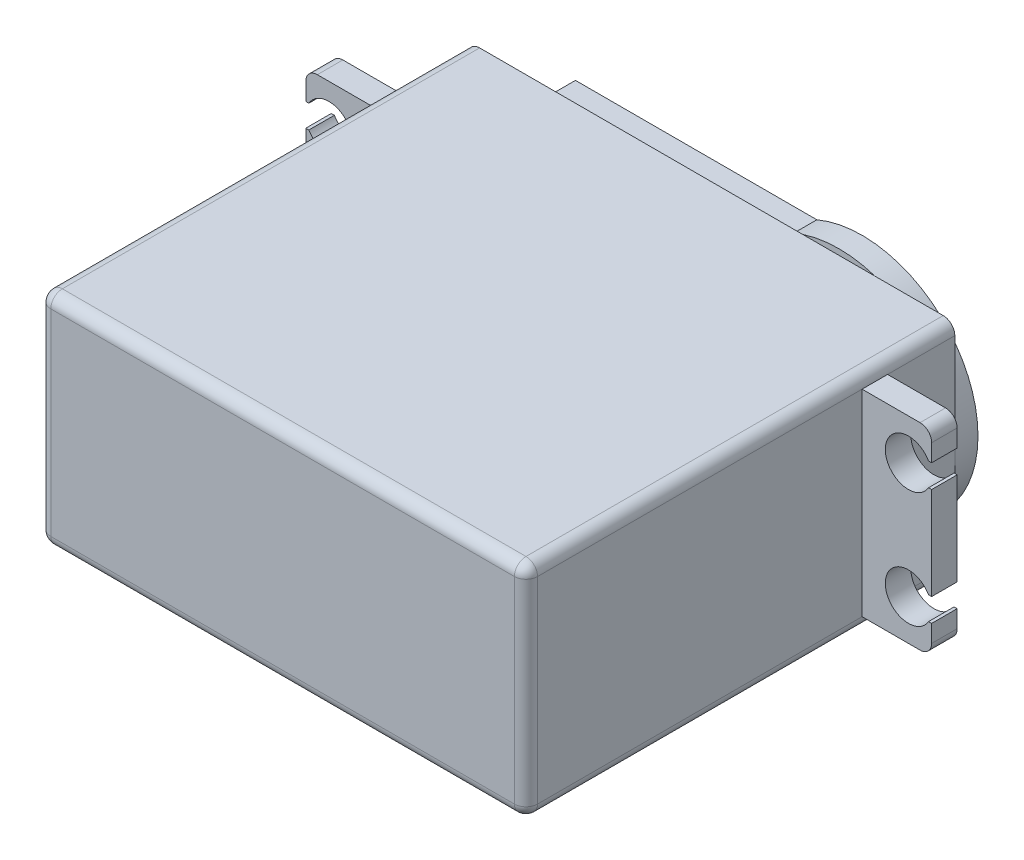
from build123d import *

# Parameters (mm, degrees)
SKETCH2_W            = 42
SKETCH2_H            = 37
BOSS_EXTRUDE1_DEPTH  = 19
FILLET1_R            = 1
FILLET2_R            = 1
SKETCH3_W            = 2.2
SKETCH3_H            = 8.5
BOSS_EXTRUDE2_DEPTH  = 6
SKETCH4_W            = 6
SKETCH4_H            = 1
BOSS_EXTRUDE3_DEPTH  = 1
CHAMFER1_SIZE2       = 1
CHAMFER1_SIZE        = 6
FILLET3_R            = 1
CUT_EXTRUDE1_DEPTH   = 6
FILLET3_OF_MIRROR9_R = 1
CHAMFER2_SIZE        = 1
CHAMFER2_SIZE_2      = 6
FILLET4_R            = 1
BOSS_EXTRUDE4_DEPTH  = 2
SKETCH9_R            = 6.574433214
BOSS_EXTRUDE5_DEPTH  = 1
SKETCH10_R           = 5.689687475
BOSS_EXTRUDE6_DEPTH  = 0.7
SKETCH11_R           = 1.55
CUT_EXTRUDE2_DEPTH   = 10


# Some blends are built 0.0001 mm under size
with BuildPart() as part:
    # Sketch2 → Boss-Extrude1 (new body)
    with BuildSketch(Plane(origin=(0, 0, 0), x_dir=(1, 0, 0), z_dir=(0, 1, 0))):
        with Locations((-10.021609405, 3.404712932)):
            Rectangle(SKETCH2_W, SKETCH2_H)
    extrude(amount=BOSS_EXTRUDE1_DEPTH)

    # Fillet1
    fillet1_edges = [part.edges().sort_by_distance(p)[0] for p in [
        (10.978390595, 19, -3.404712932),
    ]]
    fillet(fillet1_edges, radius=FILLET1_R)

    # Fillet2
    fillet2_edges = [part.edges().sort_by_distance(p)[0] for p in [
        (-31.021609405, 19, -3.404712932),
        (10.978390595, 0, -3.404712932),
        (-31.021609405, 0, -3.404712932),
    ]]
    fillet(fillet2_edges, radius=FILLET2_R)

    # Sketch3 → Boss-Extrude2 (add)
    with BuildSketch(Plane(origin=(10.978390595, 0, 0), x_dir=(0, 0, -1), z_dir=(1, 0, 0))):
        with Locations((15.004712932, 5.25)):
            Rectangle(SKETCH3_W, SKETCH3_H)
        with Locations((15.004712932, 13.75)):
            Rectangle(SKETCH3_W, SKETCH3_H)
    boss_extrude2 = extrude(amount=BOSS_EXTRUDE2_DEPTH)

    # Sketch4 → Boss-Extrude3 (add)
    with BuildSketch(Plane(origin=(0, 0, -16.104712932), x_dir=(-1, 0, 0), z_dir=(0, 0, -1))):
        with Locations((-13.978390595, 9.5)):
            Rectangle(SKETCH4_W, SKETCH4_H)
    boss_extrude3 = extrude(amount=BOSS_EXTRUDE3_DEPTH)

    # Chamfer1
    chamfer1_edges = [part.edges().sort_by_distance(p)[0] for p in [
        (16.978390595, 9.5, -17.104712932),
    ]]
    chamfer1_side = [part.faces().sort_by_distance(p)[0] for p in [
        (16.958390595, 9.5, -17.104712932),
    ]]
    chamfer(chamfer1_edges, length=CHAMFER1_SIZE - 0.0001, length2=CHAMFER1_SIZE2 - 0.0001, reference=chamfer1_side[0])  # a hair under: the kernel refuses the full size

    # Fillet3
    fillet3_edges = [part.edges().sort_by_distance(p)[0] for p in [
        (16.978390595, 18, -15.004712932),
        (16.978390595, 1, -15.004712932),
    ]]
    fillet(fillet3_edges, radius=FILLET3_R)

    # Sketch5 → Cut-Extrude1 (cut)
    with BuildSketch(Plane(origin=(0, 0, -16.104712932), x_dir=(-1, 0, 0), z_dir=(0, 0, -1))):
        with BuildLine():
            Line((-16.978390595, 15.5), (-16.978390595, 13.5))
            Line((-16.978390595, 13.5), (-16.710441403, 13.5))
            ThreePointArc((-16.710441403, 13.5), (-12.978390595, 14.5), (-16.710441403, 15.5))
            Line((-16.710441403, 15.5), (-16.978390595, 15.5))
        make_face()
        with BuildLine():
            Line((-16.978390595, 3.5), (-16.978390595, 5.5))
            Line((-16.978390595, 5.5), (-16.710441403, 5.5))
            ThreePointArc((-16.710441403, 5.5), (-12.978390595, 4.5), (-16.710441403, 3.5))
            Line((-16.710441403, 3.5), (-16.978390595, 3.5))
        make_face()
    cut_extrude1 = extrude(amount=-CUT_EXTRUDE1_DEPTH, mode=Mode.SUBTRACT)

    # Mirror9: Boss-Extrude2, Boss-Extrude3, Cut-Extrude1 across plane
    add(boss_extrude2.mirror(Plane(origin=(-10.021609405, 0, 0), x_dir=(0, 0, 1), z_dir=(1, 0, 0))))
    add(boss_extrude3.mirror(Plane(origin=(-10.021609405, 0, 0), x_dir=(0, 0, 1), z_dir=(1, 0, 0))))
    add(cut_extrude1.mirror(Plane(origin=(-10.021609405, 0, 0), x_dir=(0, 0, 1), z_dir=(1, 0, 0))), mode=Mode.SUBTRACT)

    # Fillet3 of Mirror9
    fillet3_of_mirror9_edges = [part.edges().sort_by_distance(p)[0] for p in [
        (-37.021609405, 18, -15.004712932),
        (-37.021609405, 1, -15.004712932),
    ]]
    fillet(fillet3_of_mirror9_edges, radius=FILLET3_OF_MIRROR9_R)

    # Chamfer2
    # the kernel refuses this chamfer: 6, 1 mm, written as the material it takes off along each edge
    with BuildSketch(Plane(origin=(-37.021609405, 25.592148365, -17.104712932), x_dir=(-0.22206223681747272, 0, 0.9750324932942598), z_dir=(0, -1, 0))) as chamfer2_piece_1:
        Polygon((CHAMFER2_SIZE * 0.975032493294, -CHAMFER2_SIZE * 0.222062236817), (-CHAMFER2_SIZE_2 * 0.222062236817, -CHAMFER2_SIZE_2 * 0.975032493294), (0, 0), align=None)
    extrude(amount=32.18429673, mode=Mode.SUBTRACT)

    # Fillet4
    fillet4_edges = [part.edges().sort_by_distance(p)[0] for p in [
        (10.978390595, 9.5, 15.095287068),
        (10.685497376, 18.707106781, 15.095287068),
        (-10.021609405, 19, 15.095287068),
        (-31.021609405, 9.5, 15.095287068),
        (-10.021609405, 0, 15.095287068),
        (10.685497376, 0.292893219, 15.095287068),
        (-30.728716186, 0.292893219, 15.095287068),
        (-30.728716186, 18.707106781, 15.095287068),
    ]]
    fillet(fillet4_edges, radius=FILLET4_R)

    # Sketch8 → Boss-Extrude4 (add)
    with BuildSketch(Plane(origin=(0, 0, -21.904712932), x_dir=(-1, 0, 0), z_dir=(0, 0, -1))):
        with BuildLine():
            Line((2.924068209, 18.707106781), (23.752988448, 18.707106781))
            Line((23.752988448, 18.707106781), (23.752988448, 14.023415458))
            ThreePointArc((23.752988448, 14.023415458), (25.81960193, 9.5), (23.752988448, 4.976584542))
            Line((23.752988448, 4.976584542), (23.752988448, 0.292893219))
            Line((23.752988448, 0.292893219), (2.924068209, 0.292893219))
            ThreePointArc((2.924068209, 0.292893219), (-10.978390595, 9.5), (2.924068209, 18.707106781))
        make_face()
    extrude(amount=BOSS_EXTRUDE4_DEPTH)

    # Sketch9 → Boss-Extrude5 (add)
    with BuildSketch(Plane(origin=(0, 0, -23.904712932), x_dir=(-1, 0, 0), z_dir=(0, 0, -1))):
        with Locations((-0.978390595, 9.5)):
            Circle(SKETCH9_R)
    extrude(amount=BOSS_EXTRUDE5_DEPTH)

    # Sketch10 → Boss-Extrude6 (add)
    with BuildSketch(Plane(origin=(0, 0, -24.904712932), x_dir=(-1, 0, 0), z_dir=(0, 0, -1))):
        with Locations((-0.978390595, 9.5)):
            Circle(SKETCH10_R)
    extrude(amount=BOSS_EXTRUDE6_DEPTH)

    # Sketch11 → Cut-Extrude2 (cut)
    with BuildSketch(Plane(origin=(0, 0, -25.604712932), x_dir=(-1, 0, 0), z_dir=(0, 0, -1))):
        with Locations((-0.978390595, 9.5)):
            Circle(SKETCH11_R)
    extrude(amount=-CUT_EXTRUDE2_DEPTH, mode=Mode.SUBTRACT)


solid = part.part
